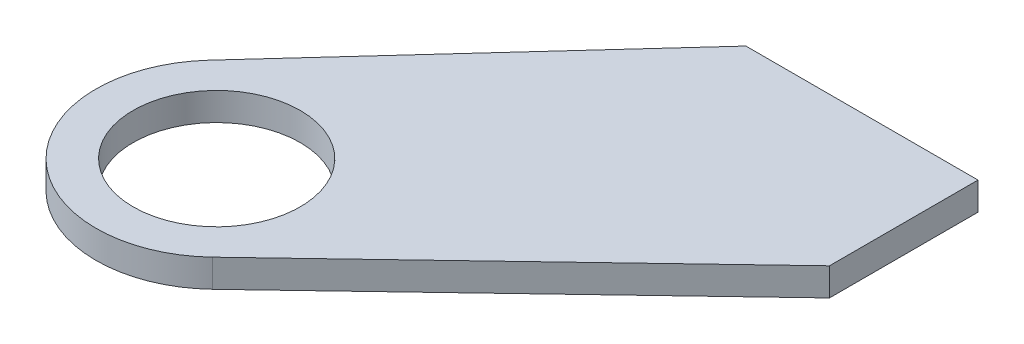
from build123d import *

# Parameters (mm, degrees)
SKETCH2_R           = 14.2875
BOSS_EXTRUDE1_DEPTH = 4.7625


with BuildPart() as part:
    # Sketch2 → Boss-Extrude1 (new body)
    with BuildSketch(Plane(origin=(0, 0, 0), x_dir=(1, 0, 0), z_dir=(0, 1, 0))):
        with BuildLine():
            Line((19.05, 0), (19.05, -25.4))
            Line((19.05, -25.4), (-34.97857102, -76.863851861))
            ThreePointArc((-34.97857102, -76.863851861), (-63.649236766, -76.668011761), (-64.455439158, -48.00801411))
            Line((-64.455439158, -48.00801411), (-20.6375, 0))
            Line((-20.6375, 0), (19.05, 0))
        make_face()
        with Locations((-49.2125, -61.920570024)):
            Circle(SKETCH2_R, mode=Mode.SUBTRACT)
    extrude(amount=BOSS_EXTRUDE1_DEPTH)


solid = part.part
